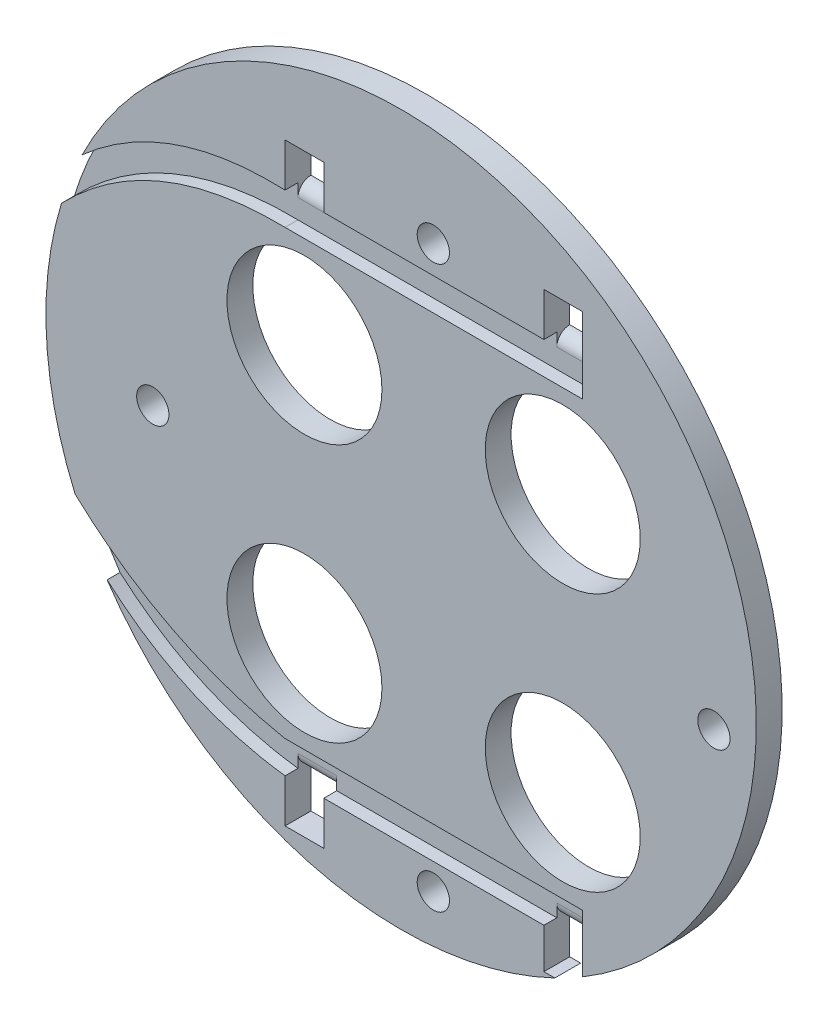
from build123d import *

# Parameters (mm, degrees)
SKETCH_2_R          = 27.501856853
EXTRUDE_1_DEPTH     = 2
SKETCH_3_R          = 1.25
CUT_EXTRUDE_1_DEPTH = 2
SKETCH_4_R          = 6
CUT_EXTRUDE_2_DEPTH = 10
SKETCH_5_W          = 3
SKETCH_5_H          = 3.366075566
SKETCH_5_H_2        = 3.372140362
SKETCH_5_H_3        = 3.114077882
CUT_EXTRUDE_3_DEPTH = 10
CUT_EXTRUDE_START   = -1
CUT_EXTRUDE_4_DEPTH = 1
FILLET_1_R          = 1


with BuildPart() as part:
    # 草图2 → 凸台-拉伸1 (new body)
    with BuildSketch(Plane.XY):
        Circle(SKETCH_2_R)
    extrude(amount=EXTRUDE_1_DEPTH)

    # 草图3 → 切除-拉伸1 (cut)
    with BuildSketch(Plane.XY.offset(2)):
        with Locations((2.49431801, 19.749253685)):
            Circle(SKETCH_3_R)
        with Locations((-19.226781008, -1.971845333)):
            Circle(SKETCH_3_R)
        with Locations((2.49431801, -23.692944351)):
            Circle(SKETCH_3_R)
        with Locations((24.215417028, -1.971845333)):
            Circle(SKETCH_3_R)
    extrude(amount=-CUT_EXTRUDE_1_DEPTH, mode=Mode.SUBTRACT)

    # 草图4 → 切除-拉伸2 (cut)
    with BuildSketch(Plane.XY.offset(2)):
        with Locations((-7.485828256, 7.959275259)):
            Circle(SKETCH_4_R)
        with Locations((12.514171744, 7.959275259)):
            Circle(SKETCH_4_R)
        with Locations((-7.485828256, -12.040724741)):
            Circle(SKETCH_4_R)
        with Locations((12.514171744, -12.040724741)):
            Circle(SKETCH_4_R)
    extrude(amount=-CUT_EXTRUDE_2_DEPTH, mode=Mode.SUBTRACT)

    # 草图5 → 切除-拉伸3 (cut)
    with BuildSketch(Plane.XY.offset(2)):
        with Locations((-7.485828256, 19.276237476)):
            Rectangle(SKETCH_5_W, SKETCH_5_H)
        with Locations((12.55261862, 19.273205078)):
            Rectangle(SKETCH_5_W, SKETCH_5_H_2)
        with Locations((-7.485828256, -23.357686958)):
            Rectangle(SKETCH_5_W, SKETCH_5_H)
        with Locations((12.55261862, -23.237595759)):
            Rectangle(SKETCH_5_W, SKETCH_5_H_3)
    extrude(amount=-CUT_EXTRUDE_3_DEPTH, mode=Mode.SUBTRACT)

    # 草图6 → 切除-拉伸4 (cut)
    with BuildSketch(Plane.XY.offset(2).offset(CUT_EXTRUDE_START)):
        with BuildLine():
            Line((14.05261862, -21.680556818), (-8.985828256, -21.680556818))
            add(Edge.make_bspline(
                [(-8.985828256, -21.680556818), (-16.825868564, -20.675103315), (-22.765275429, -15.430306704)],
                knots=[0, 0, 0, 1, 1, 1], degree=2))
            ThreePointArc((-22.765275429, -15.430306704), (-24.106708477, -13.237021446), (-25.237467212, -10.928054679))
            add(Edge.make_bspline(
                [(-8.985828256, -19.180556818), (-18.318618244, -17.354029051), (-25.237467212, -10.928054679)],
                knots=[0, 0, 0, 1, 1, 1], degree=2))
            Line((-8.985828256, -19.180556818), (14.05261862, -19.180556818))
            Line((14.05261862, -19.180556818), (14.05261862, -21.680556818))
        make_face()
        with BuildLine():
            Line((14.05261862, 17.593199693), (-8.985828256, 17.593199693))
            add(Edge.make_bspline(
                [(-8.985828256, 17.593199693), (-18.141159964, 17.936782553), (-24.69378833, 12.10656633)],
                knots=[0, 0, 0, 1, 1, 1], degree=2))
            ThreePointArc((-24.69378833, 12.10656633), (-25.574531677, 10.114121805), (-26.294813962, 8.058218729))
            add(Edge.make_bspline(
                [(-8.985828256, 15.093199693), (-19.306553581, 15.286867634), (-26.294813962, 8.058218729)],
                knots=[0, 0, 0, 1, 1, 1], degree=2))
            Line((-8.985828256, 15.093199693), (14.05261862, 15.093199693))
            Line((14.05261862, 15.093199693), (14.05261862, 17.593199693))
        make_face()
    extrude(amount=CUT_EXTRUDE_4_DEPTH, mode=Mode.SUBTRACT)

    # 圆角1
    # the kernel refuses this fillet: 1 mm, written as the material it takes off along each edge
    with BuildSketch(Plane(origin=(-8.985828256, -21.674649175, 1), x_dir=(0, 0, -1), z_dir=(1, 0, 0)), Plane(origin=(-5.985828256, 17.593199693, 1), x_dir=(0, 0, -1), z_dir=(-1, 0, 0))) as fillet_1_piece_1:
        with BuildLine():
            CenterArc((FILLET_1_R, FILLET_1_R), FILLET_1_R, 180, 90)
            Line((0, FILLET_1_R), (0, 0))
            Line((0, 0), (FILLET_1_R, 0))
        make_face()
    extrude(amount=3, mode=Mode.SUBTRACT)
    with BuildSketch(Plane(origin=(14.05261862, -21.680556818, 1), x_dir=(0, 0, -1), z_dir=(-1, 0, 0)), Plane(origin=(11.05261862, 17.587134897, 1), x_dir=(0, 0, -1), z_dir=(1, 0, 0))) as fillet_1_piece_2:
        with BuildLine():
            CenterArc((FILLET_1_R, -FILLET_1_R), FILLET_1_R, 90, 90)
            Line((0, -FILLET_1_R), (0, 0))
            Line((0, 0), (FILLET_1_R, 0))
        make_face()
    extrude(amount=3, mode=Mode.SUBTRACT)


solid = part.part
